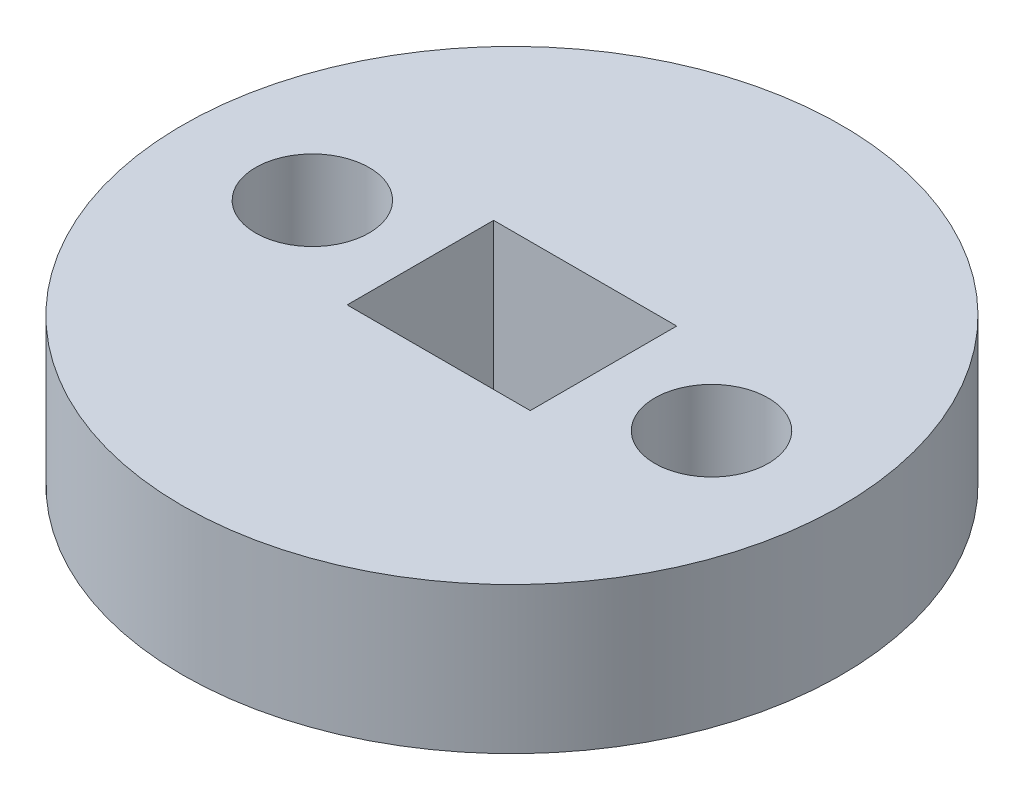
from build123d import *

# Parameters (mm, degrees)
SKETCH1_R          = 9
BASE_FLANGE1_DEPTH = 4
SKETCH7_R          = 1.55
CUT_EXTRUDE2_DEPTH = 10
SKETCH8_W          = 5
SKETCH8_H          = 4
CUT_EXTRUDE3_DEPTH = 10


# Sheet-metal steps are written as plain solids
with BuildPart() as part:
    # Sketch1 → Base-Flange1 (new body)
    with BuildSketch(Plane(origin=(0, 0, 0), x_dir=(1, 0, 0), z_dir=(0, 1, 0))):
        with Locations(Location((0, 0, 0), (0, 0, 270))):
            Circle(SKETCH1_R)
    extrude(amount=-BASE_FLANGE1_DEPTH)

    # Sketch7 → Cut-Extrude2 (cut)
    with BuildSketch(Plane(origin=(0, 0, 0), x_dir=(1, 0, 0), z_dir=(0, 1, 0))):
        with Locations(Location((-5.45, 0, 0), (0, 0, 270))):
            Circle(SKETCH7_R)
        with Locations(Location((5.45, 0, 0), (0, 0, 270))):
            Circle(SKETCH7_R)
    extrude(amount=-CUT_EXTRUDE2_DEPTH, mode=Mode.SUBTRACT)

    # Sketch8 → Cut-Extrude3 (cut)
    with BuildSketch(Plane(origin=(0, 0, 0), x_dir=(1, 0, 0), z_dir=(0, 1, 0))):
        Rectangle(SKETCH8_W, SKETCH8_H)
    extrude(amount=-CUT_EXTRUDE3_DEPTH, mode=Mode.SUBTRACT)


solid = part.part
